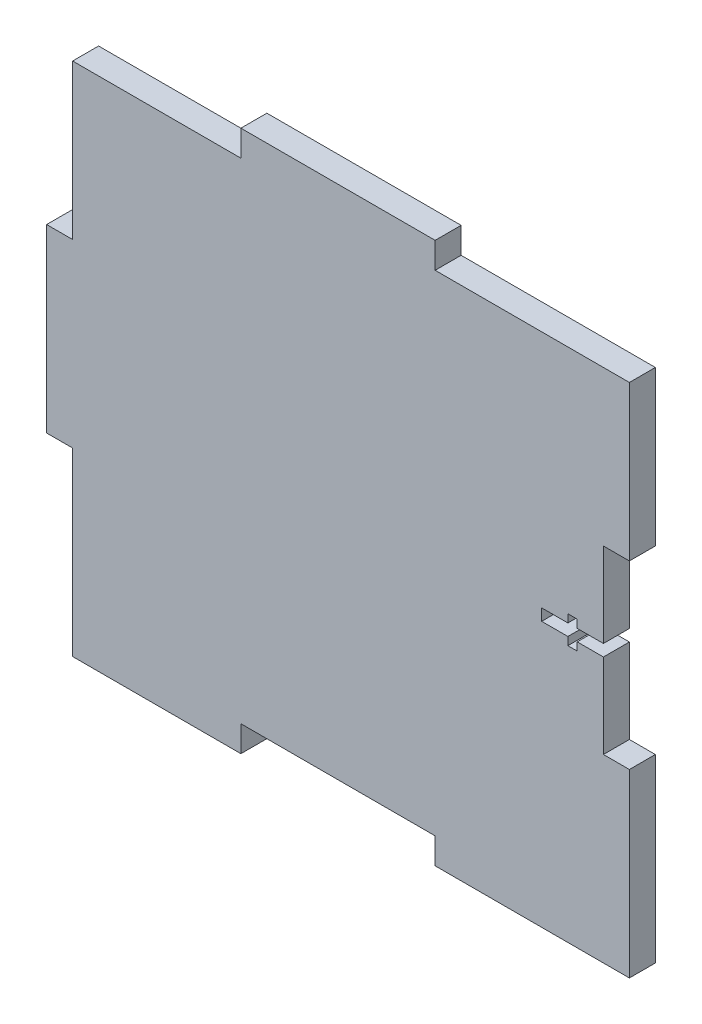
from build123d import *

# Parameters (mm, degrees)
SKETCH1_W           = 129.9464
SKETCH1_H           = 120.8024
BOSS_EXTRUDE1_DEPTH = 5.7912
SKETCH3_W           = 43.315466666
SKETCH3_H           = 5.7912
CUT_EXTRUDE2_DEPTH  = 89.900841825
SKETCH6_W           = 5.7912
SKETCH6_H           = 40.267466666
CUT_EXTRUDE5_DEPTH  = 89.900841825
SKETCH7_W           = 13.7668
SKETCH7_H           = 2.6035
CUT_EXTRUDE6_DEPTH  = 89.900841825
SKETCH8_W           = 2.0828
SKETCH8_H           = 6.1722
CUT_EXTRUDE7_DEPTH  = 89.900841825
CAVITY1_START       = -64.9732
CAVITY1_OUTLINE_W   = 40.267466667
CAVITY1_OUTLINE_H   = 5.7912
CAVITY1_DEPTH       = 5.7912
CAVITY1_START_2     = 21.657733333
CAVITY1_2_OUTLINE_W = 5.7912
CAVITY1_2_OUTLINE_H = 5.7912
CAVITY1_2_DEPTH     = 43.315466667
CAVITY1_START_3     = -59.182
CAVITY1_3_OUTLINE_W = 5.7912
CAVITY1_3_OUTLINE_H = 5.7912
CAVITY1_3_DEPTH     = 37.524266667


# Read off the part's stored shape, not the designer's step: Cavity1
with BuildPart() as part:
    # Sketch1 → Boss-Extrude1 (new body)
    with BuildSketch(Plane.XY):
        Rectangle(SKETCH1_W, SKETCH1_H)
    extrude(amount=BOSS_EXTRUDE1_DEPTH)

    # Sketch3 → Cut-Extrude2 (cut, through all)
    with BuildSketch(Plane(origin=(0, 0, 0), x_dir=(-1, 0, 0), z_dir=(0, 0, -1))):
        with Locations((0, -57.5056)):
            Rectangle(SKETCH3_W, SKETCH3_H)
    extrude(amount=-CUT_EXTRUDE2_DEPTH, mode=Mode.SUBTRACT)

    # Sketch6 → Cut-Extrude5 (cut, through all)
    with BuildSketch(Plane(origin=(0, 0, 0), x_dir=(-1, 0, 0), z_dir=(0, 0, -1))):
        with Locations((-62.0776, 0)):
            Rectangle(SKETCH6_W, SKETCH6_H)
    extrude(amount=-CUT_EXTRUDE5_DEPTH, mode=Mode.SUBTRACT)

    # Sketch7 → Cut-Extrude6 (cut, through all)
    with BuildSketch(Plane(origin=(0, 0, 0), x_dir=(-1, 0, 0), z_dir=(0, 0, -1))):
        with Locations((-52.2986, 0)):
            Rectangle(SKETCH7_W, SKETCH7_H)
    extrude(amount=-CUT_EXTRUDE6_DEPTH, mode=Mode.SUBTRACT)

    # Sketch8 → Cut-Extrude7 (cut, through all)
    with BuildSketch(Plane(origin=(0, 0, 0), x_dir=(-1, 0, 0), z_dir=(0, 0, -1))):
        with Locations((-52.2986, 0)):
            Rectangle(SKETCH8_W, SKETCH8_H)
    extrude(amount=-CUT_EXTRUDE7_DEPTH, mode=Mode.SUBTRACT)

    # Cavity1 outline → Cavity1 (cut)
    with BuildSketch(Plane.YZ.offset(CAVITY1_START)):
        with Locations((40.267466666, 2.8956)):
            Rectangle(CAVITY1_OUTLINE_W, CAVITY1_OUTLINE_H)
        with Locations((-40.267466666, 2.8956)):
            Rectangle(CAVITY1_OUTLINE_W, CAVITY1_OUTLINE_H)
    extrude(amount=CAVITY1_DEPTH, mode=Mode.SUBTRACT)

    # Cavity1 2 outline → Cavity1 2 (cut)
    with BuildSketch(Plane.YZ.offset(CAVITY1_START_2)):
        with Locations((57.5056, 2.8956)):
            Rectangle(CAVITY1_2_OUTLINE_W, CAVITY1_2_OUTLINE_H)
    extrude(amount=CAVITY1_2_DEPTH, mode=Mode.SUBTRACT)

    # Cavity1 3 outline → Cavity1 3 (cut)
    with BuildSketch(Plane.YZ.offset(CAVITY1_START_3)):
        with Locations((57.5056, 2.8956)):
            Rectangle(CAVITY1_3_OUTLINE_W, CAVITY1_3_OUTLINE_H)
    extrude(amount=CAVITY1_3_DEPTH, mode=Mode.SUBTRACT)


solid = part.part
